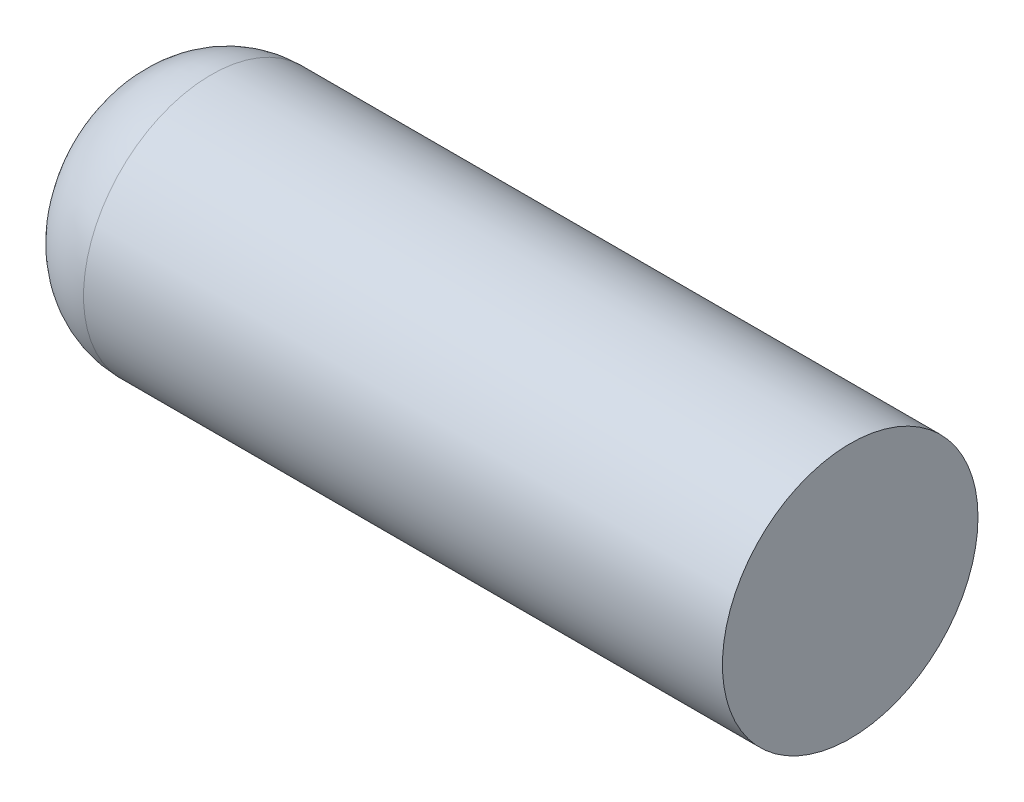
from build123d import *

# Parameters (mm, degrees)
SKETCH1_R           = 1.4
BOSS_EXTRUDE1_DEPTH = 8
FILLET1_R           = 1


with BuildPart() as part:
    # Sketch1 → Boss-Extrude1 (new body)
    with BuildSketch(Plane(origin=(0, 0, 0), x_dir=(0, 0, -1), z_dir=(1, 0, 0))):
        Circle(SKETCH1_R)
    extrude(amount=-BOSS_EXTRUDE1_DEPTH)

    # Fillet1
    fillet1_edges = [part.edges().sort_by_distance(p)[0] for p in [
        (-8, 0, 1.4),
    ]]
    fillet(fillet1_edges, radius=FILLET1_R)


solid = part.part
